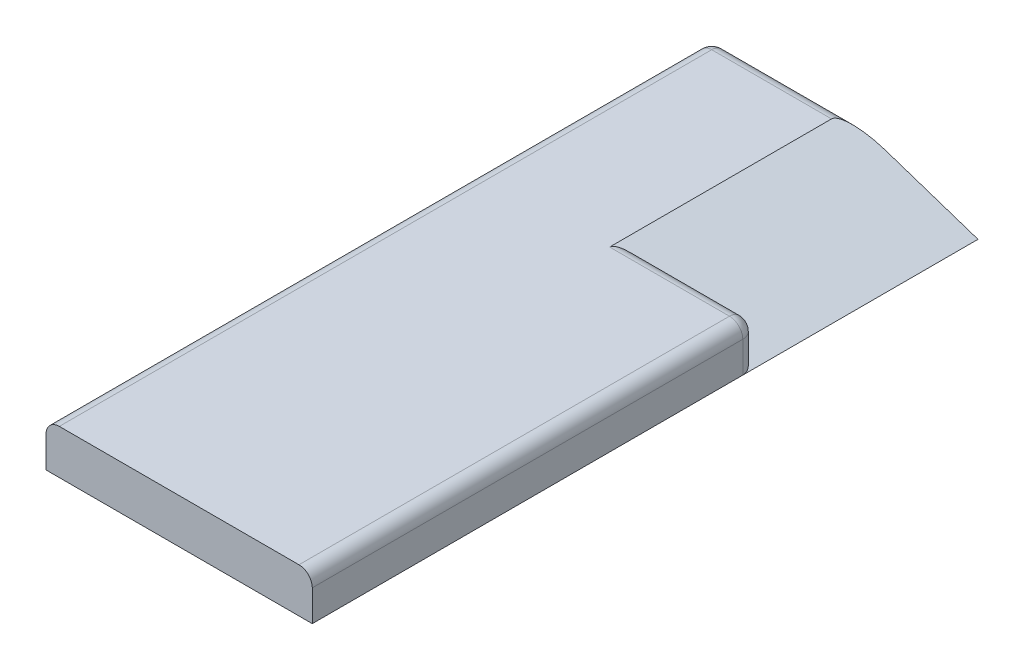
from build123d import *

# Parameters (mm, degrees)
SKETCH1_W               = 60
SKETCH1_H               = 10
BOSS_EXTRUDE1_DEPTH     = 150
CUT_EXTRUDE3_DEPTH      = 154.05227865
CUT_EXTRUDE3_DEPTH_BACK = 50
FILLET5_R               = 3
FILLET6_R               = 3
FILLET7_R               = 3


with BuildPart() as part:
    # Sketch1 → Boss-Extrude1 (new body)
    with BuildSketch(Plane.XY):
        Rectangle(SKETCH1_W, SKETCH1_H)
    extrude(amount=BOSS_EXTRUDE1_DEPTH)

    # Sketch2 → Cut-Extrude3 (cut, two sides: drawn at the far end of the back side and taken through both)
    with BuildSketch(Plane(origin=(0, 0, 0), x_dir=(-1, 0, 0), z_dir=(0, 0, -1)).offset(-CUT_EXTRUDE3_DEPTH_BACK)):
        Polygon((-30, 5), (-30, -5), (0, 5), align=None)
    extrude(amount=CUT_EXTRUDE3_DEPTH + CUT_EXTRUDE3_DEPTH_BACK, mode=Mode.SUBTRACT)

    # Fillet5
    fillet5_edges = [part.edges().sort_by_distance(p)[0] for p in [
        (15, 5, 50),
        (30, 0, 50),
        (-15, 5, 0),
    ]]
    fillet(fillet5_edges, radius=FILLET5_R)

    # Fillet6
    fillet6_edges = [part.edges().sort_by_distance(p)[0] for p in [
        (-30, -1.5, 0),
        (-30, 4.121320344, 0.878679656),
        (-30, 5, 76.5),
    ]]
    fillet(fillet6_edges, radius=FILLET6_R)

    # Fillet7
    # the kernel refuses this fillet: 3 mm, written as the material it takes off along each edge
    with BuildSketch(Plane(origin=(27, 2, 53), x_dir=(1, 0, 0), z_dir=(0, 1, 0))) as fillet7_piece_1_section:
        Polygon((0, 0), (FILLET7_R, 0), (FILLET7_R, FILLET7_R), (0, FILLET7_R), align=None)
    fillet7_piece_1 = extrude(amount=FILLET7_R, mode=Mode.PRIVATE)
    fillet7_piece_1 = fillet7_piece_1 - Plane(origin=(27, 2, 53), x_dir=(-0.7071067811865475, 0, 0.7071067811865475), z_dir=(0, 1, 0)) * Sphere(FILLET7_R, mode=Mode.PRIVATE)
    add(fillet7_piece_1, mode=Mode.SUBTRACT)
    with BuildSketch(Plane(origin=(30, 5, 53), x_dir=(-1, 0, 0), z_dir=(0, 0, 1))) as fillet7_piece_2:
        with BuildLine():
            CenterArc((FILLET7_R, FILLET7_R), FILLET7_R, 180, 90)
            Line((0, FILLET7_R), (0, 0))
            Line((0, 0), (FILLET7_R, 0))
        make_face()
    extrude(amount=104.5, mode=Mode.SUBTRACT)


solid = part.part
